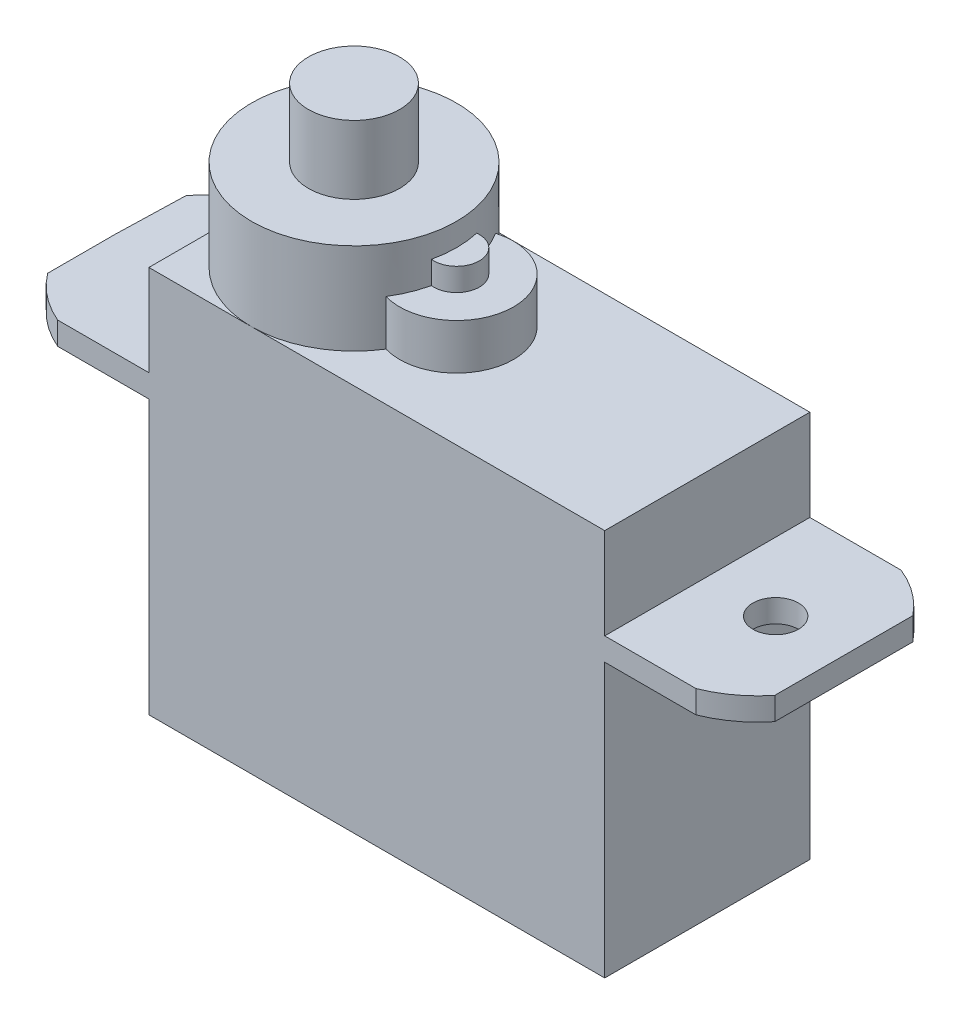
from build123d import *

# Parameters (mm, degrees)
BOSS_EXTRUDE3_DEPTH      = 4
BOSS_EXTRUDE3_DEPTH_BACK = 13
SKETCH1_W                = 20
SKETCH1_H                = 9
BOSS_EXTRUDE4_DEPTH      = 0.0001
BOSS_EXTRUDE4_DEPTH_BACK = 1
SKETCH1_3_R              = 1
SKETCH1_8_R              = 1
BOSS_EXTRUDE6_DEPTH      = 7
SKETCH1_9_R              = 2
BOSS_EXTRUDE7_DEPTH      = 11
SKETCH1_11_R             = 4.5
BOSS_EXTRUDE10_DEPTH     = 8
SKETCH1_12_R             = 2.5
BOSS_EXTRUDE11_DEPTH     = 6
CUT_EXTRUDE1_DEPTH       = 10


with BuildPart() as part:
    # Sketch1 → Boss-Extrude3 (new, two sides: drawn at the far end of the back side and taken through both)
    with BuildSketch(Plane(origin=(0, 0, 0), x_dir=(1, 0, 0), z_dir=(0, 1, 0)).offset(-BOSS_EXTRUDE3_DEPTH_BACK)):
        Rectangle(SKETCH1_W, SKETCH1_H)
    extrude(amount=BOSS_EXTRUDE3_DEPTH + BOSS_EXTRUDE3_DEPTH_BACK)

    # Sketch1<3> → Boss-Extrude4 (add, two sides: drawn at the far end of the back side and taken through both)
    # profile 1 of 2: a face of its own
    with BuildSketch(Plane(origin=(0, 0, 0), x_dir=(1, 0, 0), z_dir=(0, 1, 0)).offset(-BOSS_EXTRUDE4_DEPTH_BACK)):
        with BuildLine():
            Line((-14, -4.5), (-10, -4.5))
            Line((-10, -4.5), (-10, 4.5))
            Line((-10, 4.5), (-14, 4.5))
            ThreePointArc((-14, 4.5), (-16.985823737, 0), (-14, -4.5))
        make_face()
        with Locations((-13, 0)):
            Circle(SKETCH1_3_R, mode=Mode.SUBTRACT)
    # profile 2 of 2: a face of its own
    with BuildSketch(Plane(origin=(0, 0, 0), x_dir=(1, 0, 0), z_dir=(0, 1, 0)).offset(-BOSS_EXTRUDE4_DEPTH_BACK)):
        with BuildLine():
            Line((10, 4.5), (10, -4.5))
            Line((10, -4.5), (14, -4.5))
            ThreePointArc((14, -4.5), (17.054182563, 0), (14, 4.5))
            Line((14, 4.5), (10, 4.5))
        make_face()
        with Locations((13, 0)):
            Circle(SKETCH1_3_R, mode=Mode.SUBTRACT)
    extrude(amount=BOSS_EXTRUDE4_DEPTH + BOSS_EXTRUDE4_DEPTH_BACK)

    # Sketch1<8> → Boss-Extrude6 (add)
    with BuildSketch(Plane(origin=(0, 0, 0), x_dir=(1, 0, 0), z_dir=(0, 1, 0))):
        with Locations((-1, 0)):
            Circle(SKETCH1_8_R)
    extrude(amount=BOSS_EXTRUDE6_DEPTH)

    # Sketch1<9> → Boss-Extrude7 (add)
    with BuildSketch(Plane(origin=(0, 0, 0), x_dir=(1, 0, 0), z_dir=(0, 1, 0))):
        with Locations((-5.5, 0)):
            Circle(SKETCH1_9_R)
    extrude(amount=BOSS_EXTRUDE7_DEPTH)

    # Sketch1<11> → Boss-Extrude10 (add)
    with BuildSketch(Plane(origin=(0, 0, 0), x_dir=(1, 0, 0), z_dir=(0, 1, 0))):
        with Locations((-5.5, 0)):
            Circle(SKETCH1_11_R)
    extrude(amount=BOSS_EXTRUDE10_DEPTH)

    # Sketch1<12> → Boss-Extrude11 (add)
    with BuildSketch(Plane(origin=(0, 0, 0), x_dir=(1, 0, 0), z_dir=(0, 1, 0))):
        with Locations((-1, 0)):
            Circle(SKETCH1_12_R)
    extrude(amount=BOSS_EXTRUDE11_DEPTH)

    # Sketch5 → Cut-Extrude1 (cut)
    with BuildSketch(Plane(origin=(0, 0.0001, 0), x_dir=(1, 0, 0), z_dir=(0, 1, 0))):
        Polygon((15.989756793, 0), (15.989756793, 5), (17.989756793, 5), (17.989756793, -5), (15.989756793, -5), align=None)
        Polygon((-16, 0), (-15.859574775, 4.998027687), (-17.85878585, 5.054197777), (-18.141269876, -5), (-16, -5), align=None)
    extrude(amount=-CUT_EXTRUDE1_DEPTH, mode=Mode.SUBTRACT)


solid = part.part
